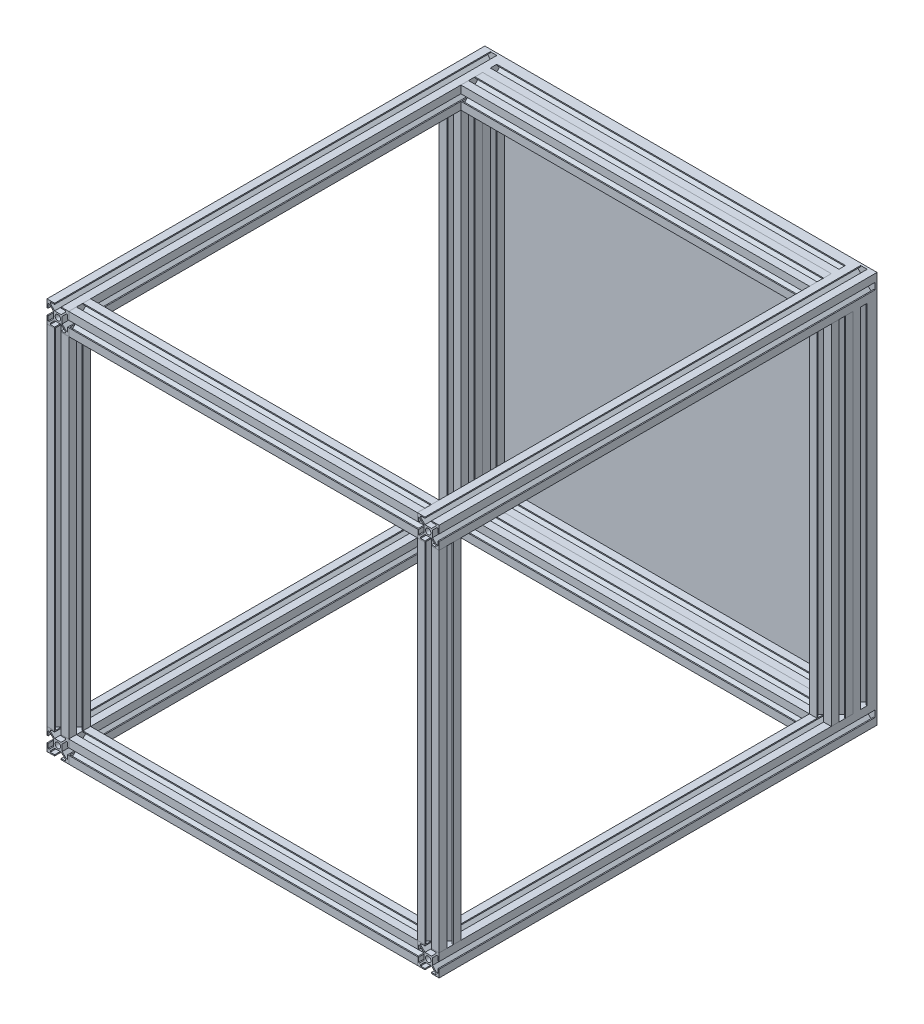
from build123d import *

# Parameters (mm, degrees)
SKETCH2_R                        = 2.5
CIRPATTERN1_COUNT                = 4
SKETCH4_R                        = 2.5
ALUMINIUM_EXTRUSION_PILLAR_DEPTH = 400
CIRPATTERN2_COUNT                = 4
SKETCH5_W                        = 360
SKETCH5_H                        = 360
SKETCH5_R                        = 2.5
BOSS_EXTRUDE9_DEPTH              = 2


with BuildPart() as part:
    # Aluminium Extrsion Base: sweep along a path in Sketch1
    with BuildLine(Plane(origin=(0, 0, 0), x_dir=(0, 1, 0), z_dir=(0, 0, 1))) as aluminium_extrsion_base_path:
        Line((-160, 160), (-160, -160))
    # Sketch2 → Aluminium Extrsion Base (sweep)
    with BuildSketch(Plane.YZ):
        Polygon((-180, 3), (-180, 10), (-173, 10), (-173, 9), (-177, 9), (-177, 7.985679549), (-173, 3.985679549), (-170, 3.985679549), (-167, 3.985679549), (-163, 7.985679549), (-163, 9), (-167, 9), (-167, 10), (-160, 10), (-160, 3), (-161, 3), (-161, 7), (-162.014320451, 7), (-166.014320451, 3), (-166.014320451, 0), (-166.014320451, -3), (-162.014320451, -7), (-161, -7), (-161, -3), (-160, -3), (-160, -10), (-167, -10), (-167, -9), (-163, -9), (-163, -7.985679549), (-167, -3.985679549), (-170, -3.985679549), (-173, -3.985679549), (-177, -7.985679549), (-177, -9), (-173, -9), (-173, -10), (-180, -10), (-180, -3), (-179, -3), (-179, -7), (-177.985679549, -7), (-173.985679549, -3), (-173.985679549, 0), (-173.985679549, 3), (-177.985679549, 7), (-179, 7), (-179, 3), align=None)
        with Locations((-170, 0)):
            Circle(SKETCH2_R, mode=Mode.SUBTRACT)
    sweep(path=aluminium_extrsion_base_path.line)


with BuildPart() as cirpattern1_1:
    # CirPattern1: pattern copy
    add(part.part.rotate(Axis((0, 0, 0), (0, 0, 1)), 1 * 360 / CIRPATTERN1_COUNT))


with BuildPart() as cirpattern1_2:
    # CirPattern1: pattern copy
    add(part.part.rotate(Axis((0, 0, 0), (0, 0, 1)), 2 * 360 / CIRPATTERN1_COUNT))


with BuildPart() as cirpattern1_3:
    # CirPattern1: pattern copy
    add(part.part.rotate(Axis((0, 0, 0), (0, 0, 1)), 3 * 360 / CIRPATTERN1_COUNT))


with BuildPart() as body_5:
    # Mirror5: mirrored copy
    add(cirpattern1_1.part.mirror(Plane(origin=(-160, 167, 10), x_dir=(1, 0, 0), z_dir=(0, 0, -1))))


with BuildPart() as body_6:
    # Mirror5 2: mirrored copy
    add(part.part.mirror(Plane(origin=(-160, 167, 10), x_dir=(1, 0, 0), z_dir=(0, 0, -1))))


with BuildPart() as body_7:
    # Mirror5 3: mirrored copy
    add(cirpattern1_3.part.mirror(Plane(origin=(-160, 167, 10), x_dir=(1, 0, 0), z_dir=(0, 0, -1))))


with BuildPart() as body_8:
    # Mirror5 4: mirrored copy
    add(cirpattern1_2.part.mirror(Plane(origin=(-160, 167, 10), x_dir=(1, 0, 0), z_dir=(0, 0, -1))))


with BuildPart() as body_9:
    # Sketch4 → Aluminium Extrusion Pillar (new body)
    with BuildSketch(Plane(origin=(0, 0, -10), x_dir=(0, 1, 0), z_dir=(0, 0, 1))):
        Polygon((-180, -167), (-180, -160), (-173, -160), (-173, -161), (-177, -161), (-177, -162.089574502), (-173, -166.089574502), (-170, -166.089574502), (-167, -166.089574502), (-163, -162.089574502), (-163, -161), (-167, -161), (-167, -160), (-160, -160), (-160, -167), (-161, -167), (-161, -163), (-162.089574502, -163), (-166.089574502, -167), (-166.089574502, -170), (-166.089574502, -173), (-162.089574502, -177), (-161, -177), (-161, -173), (-160, -173), (-160, -180), (-167, -180), (-167, -179), (-163, -179), (-163, -177.910425498), (-167, -173.910425498), (-170, -173.910425498), (-173, -173.910425498), (-177, -177.910425498), (-177, -179), (-173, -179), (-173, -180), (-180, -180), (-180, -173), (-179, -173), (-179, -177), (-177.910425498, -177), (-173.910425498, -173), (-173.910425498, -170), (-173.910425498, -167), (-177.910425498, -163), (-179, -163), (-179, -167), align=None)
        with Locations((-170, -170)):
            Circle(SKETCH4_R, mode=Mode.SUBTRACT)
    extrude(amount=ALUMINIUM_EXTRUSION_PILLAR_DEPTH)


with BuildPart() as cirpattern2_1:
    # CirPattern2: pattern copy
    add(body_9.part.rotate(Axis((0, 0, 0), (0, 0, 1)), 1 * 360 / CIRPATTERN2_COUNT))


with BuildPart() as cirpattern2_2:
    # CirPattern2: pattern copy
    add(body_9.part.rotate(Axis((0, 0, 0), (0, 0, 1)), 2 * 360 / CIRPATTERN2_COUNT))


with BuildPart() as cirpattern2_3:
    # CirPattern2: pattern copy
    add(body_9.part.rotate(Axis((0, 0, 0), (0, 0, 1)), 3 * 360 / CIRPATTERN2_COUNT))


with BuildPart() as body_13:
    # Mirror4: mirrored copy
    add(cirpattern1_3.part.mirror(Plane.XY.offset(190)))


with BuildPart() as body_14:
    # Mirror4 2: mirrored copy
    add(part.part.mirror(Plane.XY.offset(190)))


with BuildPart() as body_15:
    # Mirror4 3: mirrored copy
    add(cirpattern1_1.part.mirror(Plane.XY.offset(190)))


with BuildPart() as body_16:
    # Mirror4 4: mirrored copy
    add(cirpattern1_2.part.mirror(Plane.XY.offset(190)))


with BuildPart() as part_1:
    add(part.part)

    add(cirpattern1_1.part)  # Boss-Extrude9 merges CirPattern1_1

    add(cirpattern1_2.part)  # Boss-Extrude9 merges CirPattern1_2

    add(cirpattern1_3.part)  # Boss-Extrude9 merges CirPattern1_3

    add(body_9.part)  # Boss-Extrude9 merges body 9

    add(cirpattern2_1.part)  # Boss-Extrude9 merges CirPattern2_1

    add(cirpattern2_2.part)  # Boss-Extrude9 merges CirPattern2_2

    add(cirpattern2_3.part)  # Boss-Extrude9 merges CirPattern2_3
    # Sketch5 → Boss-Extrude9 (add)
    with BuildSketch(Plane(origin=(0, 0, -10), x_dir=(1, 0, 0), z_dir=(0, 0, -1))):
        Rectangle(SKETCH5_W, SKETCH5_H)
        with Locations((-170, -170)):
            Circle(SKETCH5_R, mode=Mode.SUBTRACT)
        with Locations((170, -170)):
            Circle(SKETCH5_R, mode=Mode.SUBTRACT)
        with Locations((170, 170)):
            Circle(SKETCH5_R, mode=Mode.SUBTRACT)
        with Locations((-170, 170)):
            Circle(SKETCH5_R, mode=Mode.SUBTRACT)
    extrude(amount=BOSS_EXTRUDE9_DEPTH)


solid = Compound([body_5.part, body_6.part, body_7.part, body_8.part, body_13.part, body_14.part, body_15.part, body_16.part, part_1.part])
